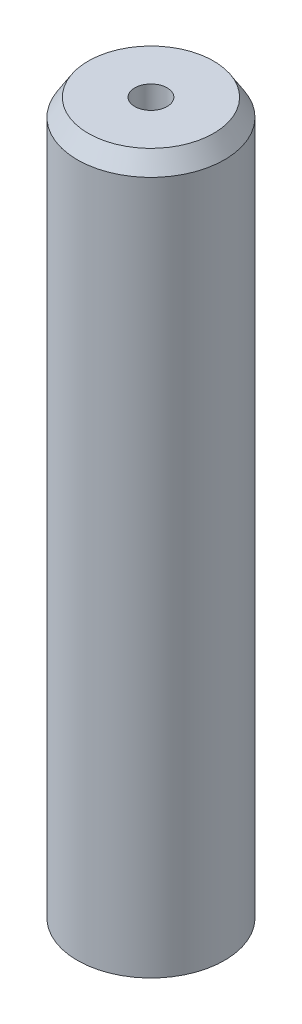
from build123d import *
from OCP.BRepFilletAPI import BRepFilletAPI_MakeChamfer

# Parameters (mm, degrees)
SKETCH1_R           = 5
BOSS_EXTRUDE1_DEPTH = 49.038461374
SKETCH2_R           = 1.101361906
CUT_EXTRUDE1_DEPTH  = 50.545642533
CHAMFER1_SIZE       = 1.185321379
CHAMFER1_SIZE2      = 0.739883508


with BuildPart() as part:
    # Sketch1 → Boss-Extrude1 (new body)
    with BuildSketch(Plane(origin=(0, 0, 0), x_dir=(1, 0, 0), z_dir=(0, 1, 0))):
        Circle(SKETCH1_R)
    extrude(amount=BOSS_EXTRUDE1_DEPTH)

    # Sketch2 → Cut-Extrude1 (cut, through all)
    with BuildSketch(Plane(origin=(0, 0, 0), x_dir=(1, 0, 0), z_dir=(0, 1, 0))):
        Circle(SKETCH2_R)
    extrude(amount=CUT_EXTRUDE1_DEPTH, mode=Mode.SUBTRACT)

    # Chamfer1: one chamfer whose edges measure the first distance from different faces: ONE call of the kernel's chamfer builder (chamfer() names one face for all edges)
    chamfer1_edges_1 = [part.edges().sort_by_distance(p)[0] for p in [
        (-5, 49.038461374, 0),
    ]]
    chamfer1_side_1 = [part.faces().sort_by_distance(p)[0] for p in [
        (-5, 24.519230687, 0),
    ]]
    chamfer1_edges_2 = [part.edges().sort_by_distance(p)[0] for p in [
        (-5, 0, 0),
    ]]
    chamfer1_side_2 = [part.faces().sort_by_distance(p)[0] for p in [
        (-4.858578644, 0, 0),
    ]]
    chamfer1 = BRepFilletAPI_MakeChamfer(part.part.solid().wrapped)
    for e in chamfer1_edges_1:
        chamfer1.Add(CHAMFER1_SIZE, CHAMFER1_SIZE2, e.wrapped, chamfer1_side_1[0].wrapped)  # the first distance lies on this face
    for e in chamfer1_edges_2:
        chamfer1.Add(CHAMFER1_SIZE, CHAMFER1_SIZE2, e.wrapped, chamfer1_side_2[0].wrapped)  # the first distance lies on this face
    add(Compound.cast(chamfer1.Shape()), mode=Mode.REPLACE)


solid = part.part
